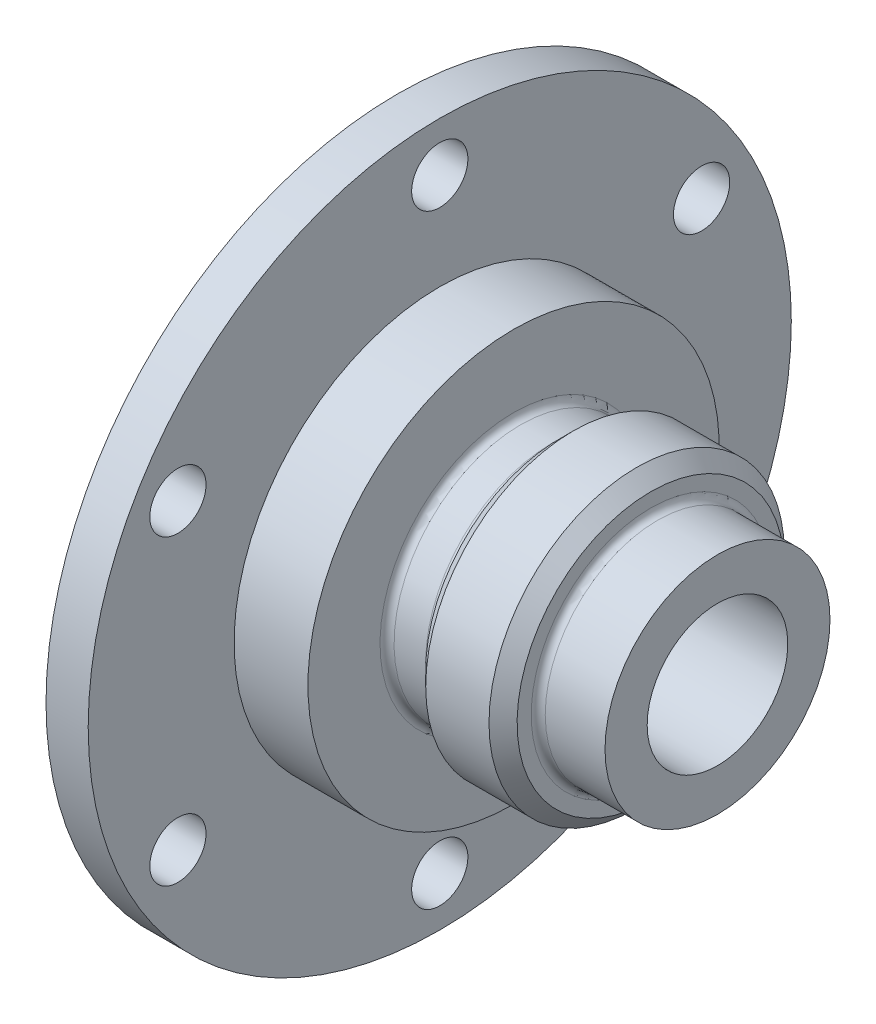
from build123d import *

# Parameters (mm, degrees)
SKETCH2_W     = 9.5
SKETCH2_H     = 22.25
SKETCH2_W_2   = 36
SKETCH2_H_2   = 10
HOLE1_D       = 8
CHAMFER1_SIZE = 2
FILLET1_R     = 1


with BuildPart() as part:
    # Sketch1 → Revolve1 (revolve)
    with BuildSketch(Plane.XY):
        Polygon((0, 0), (0, 50), (6, 50), (6, 29.25), (16.5, 29.25), (16.5, 18), (23, 18), (23, 21), (36, 21), (36, 16), (45.5, 16), (45.5, 0), align=None)
    revolve(axis=Axis((45.5, 0, 0), (-1, 0, 0)))

    # Sketch2 → Cut-Revolve1 (revolve, cut)
    with BuildSketch(Plane.XY, mode=Mode.PRIVATE) as cut_revolve1_sk:
        with Locations((4.75, 11.125)):
            Rectangle(SKETCH2_W, SKETCH2_H)
        with Locations((27.5, 5)):
            Rectangle(SKETCH2_W_2, SKETCH2_H_2)
    revolve(cut_revolve1_sk.sketch.rotate(Axis((0, 0, 0), (1, 0, 0)), 90), axis=Axis((0, 0, 0), (1, 0, 0)), mode=Mode.SUBTRACT)

    # Hole1 (through all)
    with Locations(Plane.ZY):
        with Locations((0, 0), (0, 43), (37.239092363, 21.5), (37.239092363, -21.5), (0, -43), (-37.239092363, -21.5), (-37.239092363, 21.5)):
            Hole(HOLE1_D / 2)

    # Chamfer1
    chamfer1_edges = [part.edges().sort_by_distance(p)[0] for p in [
        (36, -21, 0),
        (23, -21, 0),
    ]]
    chamfer(chamfer1_edges, length=CHAMFER1_SIZE)

    # Fillet1
    fillet1_edges = [part.edges().sort_by_distance(p)[0] for p in [
        (36, -16, 0),
        (23, -18, 0),
        (16.5, -18, 0),
    ]]
    fillet(fillet1_edges, radius=FILLET1_R - 0.0001)  # a hair under: the kernel refuses the full size


solid = part.part
